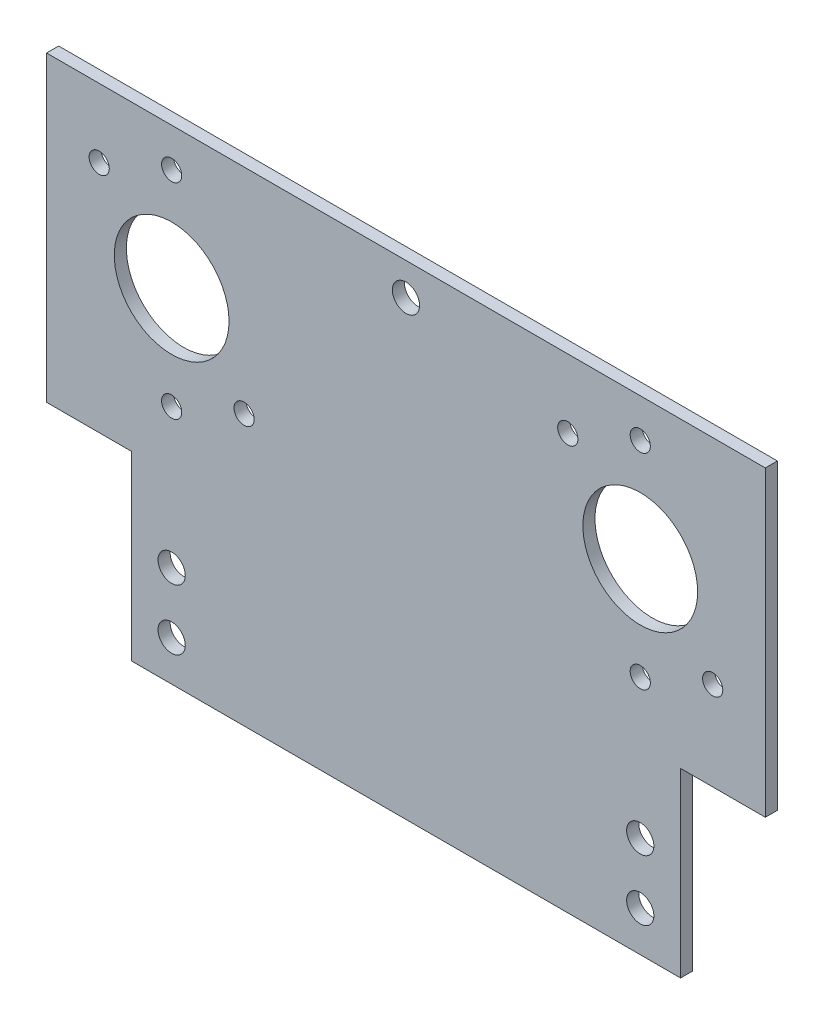
from build123d import *

# Parameters (mm, degrees)
SKETCH1_W           = 178.16
SKETCH1_H           = 120
BOSS_EXTRUDE1_DEPTH = 3
SKETCH2_R           = 14.225
SKETCH2_R_2         = 3.375
CUT_EXTRUDE1_DEPTH  = 215.825477074
SKETCH3_R           = 2.0193
CUT_EXTRUDE2_DEPTH  = 215.825477074
SKETCH6_R           = 2.5
CUT_EXTRUDE3_DEPTH  = 215.825477074
SKETCH7_W           = 21
SKETCH7_H           = 45
CUT_EXTRUDE4_DEPTH  = 215.825477074


with BuildPart() as part:
    # Sketch1 → Boss-Extrude1 (new body)
    with BuildSketch(Plane.XY):
        with Locations((89.08, -60)):
            Rectangle(SKETCH1_W, SKETCH1_H)
    extrude(amount=BOSS_EXTRUDE1_DEPTH)

    # Sketch2 → Cut-Extrude1 (cut, through all)
    with BuildSketch(Plane.XY.offset(3)):
        with Locations((31, -35)):
            Circle(SKETCH2_R)
        with Locations((147.16, -35)):
            Circle(SKETCH2_R)
        with Locations((31, -110)):
            Circle(SKETCH2_R_2)
        with Locations((147.16, -110)):
            Circle(SKETCH2_R_2)
        with Locations((89.08, -8)):
            Circle(SKETCH2_R_2)
        with Locations((31, -95)):
            Circle(SKETCH2_R_2)
        with Locations((147.16, -95)):
            Circle(SKETCH2_R_2)
    extrude(amount=-CUT_EXTRUDE1_DEPTH, mode=Mode.SUBTRACT)

    # Sketch3 → Cut-Extrude2 (cut, through all)
    with BuildSketch(Plane(origin=(0, 0, 0), x_dir=(-1, 0, 0), z_dir=(0, 0, -1))):
        with Locations((-48.960512242, -52.960512242)):
            Circle(SKETCH3_R)
        with Locations((-31, -9.6)):
            Circle(SKETCH3_R)
        with Locations((-13.039487758, -17.039487758)):
            Circle(SKETCH3_R)
        with Locations((-31, -60.4)):
            Circle(SKETCH3_R)
        with Locations((-129.199487758, -17.039487758)):
            Circle(SKETCH3_R)
        with Locations((-147.16, -9.6)):
            Circle(SKETCH3_R)
        with Locations((-147.16, -60.4)):
            Circle(SKETCH3_R)
        with Locations((-165.120512242, -52.960512242)):
            Circle(SKETCH3_R)
    extrude(amount=-CUT_EXTRUDE2_DEPTH, mode=Mode.SUBTRACT)

    # Sketch6 → Cut-Extrude3 (cut, through all)
    with BuildSketch(Plane.XY.offset(3)):
        with Locations((31, -60.4)):
            Circle(SKETCH6_R)
        with Locations((48.960512242, -52.960512242)):
            Circle(SKETCH6_R)
        with Locations((31, -9.6)):
            Circle(SKETCH6_R)
        with Locations((13.039487758, -17.039487758)):
            Circle(SKETCH6_R)
        with Locations((165.120512242, -52.960512242)):
            Circle(SKETCH6_R)
        with Locations((147.16, -60.4)):
            Circle(SKETCH6_R)
        with Locations((129.199487758, -17.039487758)):
            Circle(SKETCH6_R)
        with Locations((147.16, -9.6)):
            Circle(SKETCH6_R)
    extrude(amount=-CUT_EXTRUDE3_DEPTH, mode=Mode.SUBTRACT)

    # Sketch7 → Cut-Extrude4 (cut, through all)
    with BuildSketch(Plane.XY.offset(3)):
        with Locations((167.66, -97.5)):
            Rectangle(SKETCH7_W, SKETCH7_H)
        with Locations((10.5, -97.5)):
            Rectangle(SKETCH7_W, SKETCH7_H)
    extrude(amount=-CUT_EXTRUDE4_DEPTH, mode=Mode.SUBTRACT)


solid = part.part
